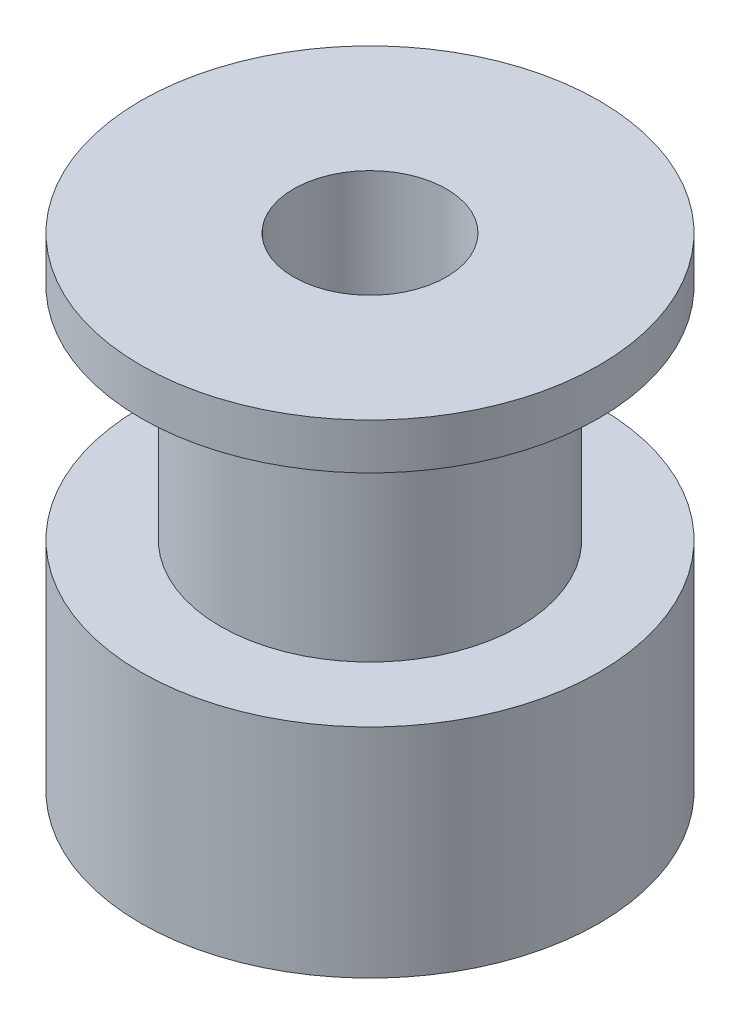
from build123d import *

# Parameters (mm, degrees)
SKETCH1_R           = 7.5
BOSS_EXTRUDE1_DEPTH = 7.12
SKETCH2_R           = 4.9
BOSS_EXTRUDE2_DEPTH = 7.2
SKETCH3_R           = 7.5
BOSS_EXTRUDE3_DEPTH = 1.5
SKETCH4_R           = 2.5
CUT_EXTRUDE1_DEPTH  = 20.046584996


with BuildPart() as part:
    # Sketch1 → Boss-Extrude1 (new body)
    with BuildSketch(Plane(origin=(0, 0, 0), x_dir=(1, 0, 0), z_dir=(0, 1, 0))):
        Circle(SKETCH1_R)
    extrude(amount=BOSS_EXTRUDE1_DEPTH)

    # Sketch2 → Boss-Extrude2 (add)
    with BuildSketch(Plane(origin=(0, 7.12, 0), x_dir=(1, 0, 0), z_dir=(0, 1, 0))):
        Circle(SKETCH2_R)
    extrude(amount=BOSS_EXTRUDE2_DEPTH)

    # Sketch3 → Boss-Extrude3 (add)
    with BuildSketch(Plane(origin=(0, 14.32, 0), x_dir=(1, 0, 0), z_dir=(0, 1, 0))):
        Circle(SKETCH3_R)
    extrude(amount=BOSS_EXTRUDE3_DEPTH)

    # Sketch4 → Cut-Extrude1 (cut, through all)
    with BuildSketch(Plane(origin=(0, 15.82, 0), x_dir=(1, 0, 0), z_dir=(0, 1, 0))):
        Circle(SKETCH4_R)
    extrude(amount=-CUT_EXTRUDE1_DEPTH, mode=Mode.SUBTRACT)


solid = part.part
